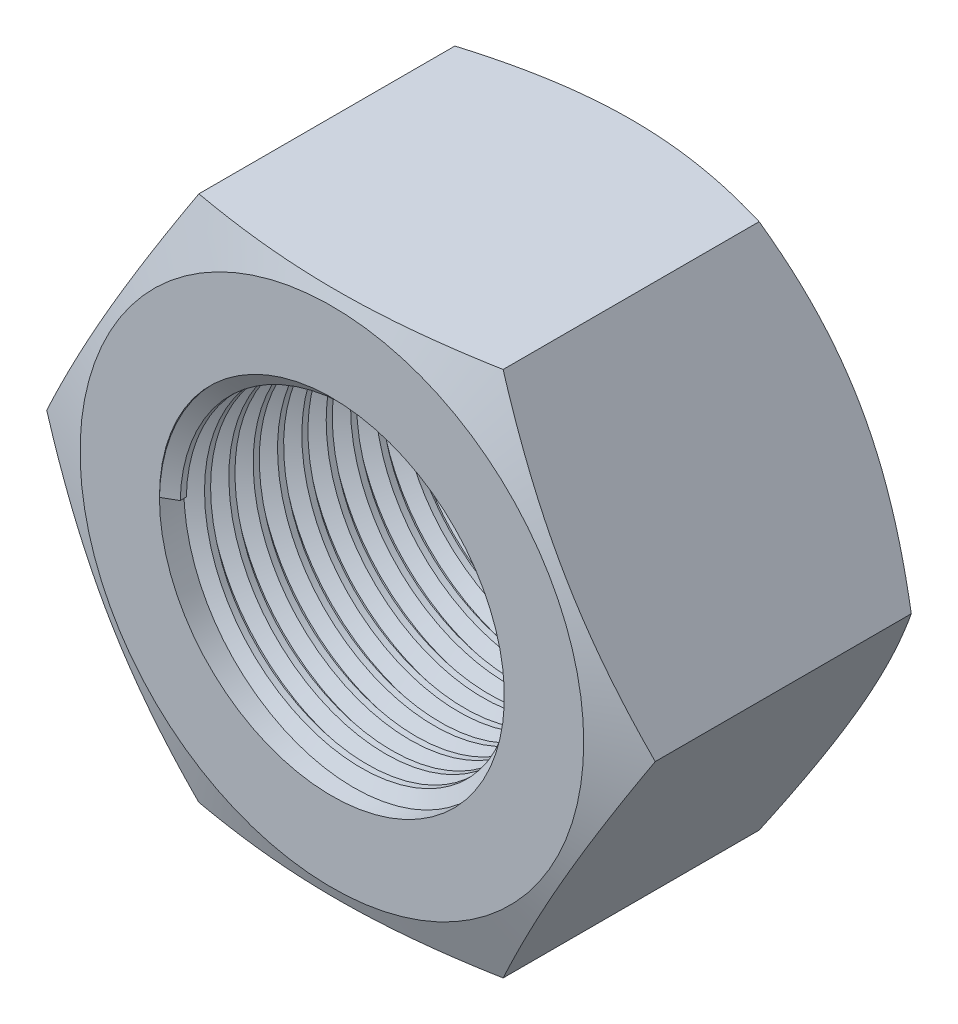
from build123d import *

# Parameters (mm, degrees)
CROQUIS1_R              = 9
SALIENTE_EXTRUIR1_DEPTH = 16
ROSCA1_PITCH            = 1.27
CROQUIS4_R              = 50
CROQUIS4_R_2            = 13.140794451
CORTAR_EXTRUIR1_DEPTH   = 8
CORTAR_EXTRUIR1_DRAFT   = -70
CROQUIS5_R              = 70.447687099
CROQUIS5_R_2            = 13.140794451
CORTAR_EXTRUIR2_DEPTH   = 16
CORTAR_EXTRUIR2_DRAFT   = -59


with BuildPart() as part:
    # Croquis1 → Saliente-Extruir1 (new body)
    with BuildSketch(Plane.XY):
        Polygon((15.877132403, 0), (7.938566201, 13.75), (-7.938566201, 13.75), (-15.877132403, 0), (-7.938566201, -13.75), (7.938566201, -13.75), align=None)
        Circle(CROQUIS1_R, mode=Mode.SUBTRACT)
    extrude(amount=SALIENTE_EXTRUIR1_DEPTH)

    # Rosca1: the profile of Perfil de rosca1 profile screwed along a right-hand helix of 11.811024 turns, 8 arcs to a turn; built about Z, then put on its axis
    rosca1_z = Axis((0, 0, 0), (0, 0, 1))
    rosca1_corners = [(9.0003, 0, -0.000173205), (9.0003, 0, 1.111423202), (8.312592339, 0, 0.714374998), (8.312592339, 0, 0.396874998)]
    with BuildLine(mode=Mode.PRIVATE) as rosca1_profile:
        Line(rosca1_corners[0], rosca1_corners[1])
        Line(rosca1_corners[1], rosca1_corners[2])
        Line(rosca1_corners[2], rosca1_corners[3])
        Line(rosca1_corners[3], rosca1_corners[0])
    rosca1_cap = Face(rosca1_profile.wire())
    rosca1_turn_angles = [0, 22.5, 45, 67.5, 90, 112.5, 135, 157.5, 180, 202.5, 225, 247.5, 270, 292.5, 315, 337.5, 360]
    rosca1_turn_weights = [1, 0.9238795325112867, 1, 0.9238795325112867, 1, 0.9238795325112867, 1, 0.9238795325112867, 1, 0.9238795325112867, 1, 0.9238795325112867, 1, 0.9238795325112867, 1, 0.9238795325112867, 1]
    rosca1_turn_rails = [Edge.make_bspline([Vector(p[0], p[1], 0).rotate(rosca1_z, rosca1_turn_angles[k]) / rosca1_turn_weights[k] + Vector(0, 0, p[2] + ROSCA1_PITCH * rosca1_turn_angles[k] / 360) for k in range(17)], [0, 0, 0, 1, 1, 2, 2, 3, 3, 4, 4, 5, 5, 6, 6, 7, 7, 8, 8, 8], 2, rosca1_turn_weights) for p in rosca1_corners]
    rosca1_turn_sides = [Face.make_surface_from_curves(rosca1_turn_rails[p[0]], rosca1_turn_rails[p[1]]) for p in [(0, 1), (1, 2), (2, 3), (3, 0)]]
    rosca1_last_angles = [3960, 3982.5, 4005, 4027.5, 4050, 4072.5, 4095, 4117.5, 4140, 4162.5, 4185, 4207.5, 4230, 4240.984251969, 4251.968503937]
    rosca1_last_weights = [1, 0.9238795325112867, 1, 0.9238795325112867, 1, 0.9238795325112867, 1, 0.9238795325112867, 1, 0.9238795325112867, 1, 0.9238795325112867, 1, 0.981679591174842, 1]
    rosca1_last_rails = [Edge.make_bspline([Vector(p[0], p[1], 0).rotate(rosca1_z, rosca1_last_angles[k]) / rosca1_last_weights[k] + Vector(0, 0, p[2] + ROSCA1_PITCH * rosca1_last_angles[k] / 360) for k in range(15)], [0, 0, 0, 1, 1, 2, 2, 3, 3, 4, 4, 5, 5, 6, 6, 7, 7, 7], 2, rosca1_last_weights) for p in rosca1_corners]
    rosca1_last_sides = [Face.make_surface_from_curves(rosca1_last_rails[p[0]], rosca1_last_rails[p[1]]) for p in [(0, 1), (1, 2), (2, 3), (3, 0)]]
    rosca1 = Plane(origin=(0, 0, 16), x_dir=(-1, 0, 0), z_dir=(0, 0, -1)) * Solid(Shell([*[p.moved(Location((0, 0, ROSCA1_PITCH * i))) for i in range(11) for p in rosca1_turn_sides], *rosca1_last_sides, rosca1_cap, rosca1_cap.rotate(rosca1_z, 4251.968503937).moved(Location((0, 0, ROSCA1_PITCH * 4251.968503937 / 360)))]))
    add(rosca1)


with BuildPart() as cortar_extruir1_tool:
    # Croquis4 → Cortar-Extruir1 (with draft: the straight prism first)
    with BuildSketch(Plane.XY.offset(16)):
        Circle(CROQUIS4_R)
        Circle(CROQUIS4_R_2, mode=Mode.SUBTRACT)
    extrude(amount=-CORTAR_EXTRUIR1_DEPTH)
    # Cortar-Extruir1: the draft: its side faces are tilted about the plane it starts from
    cortar_extruir1_sides = [cortar_extruir1_tool.faces().sort_by_distance(p)[0] for p in [
        (-50, 0, 12),
        (-13.140794451, 0, 12),
    ]]
    draft(cortar_extruir1_sides, Plane.XY.offset(16), CORTAR_EXTRUIR1_DRAFT)


with BuildPart() as part_1:
    add(part.part)

    # Cortar-Extruir1: cut by cortar_extruir1_tool
    add(cortar_extruir1_tool.part, mode=Mode.SUBTRACT)


with BuildPart() as cortar_extruir2_tool:
    # Croquis5 → Cortar-Extruir2 (with draft: the straight prism first)
    with BuildSketch(Plane(origin=(0, 0, 0), x_dir=(-1, 0, 0), z_dir=(0, 0, -1))):
        Circle(CROQUIS5_R)
        Circle(CROQUIS5_R_2, mode=Mode.SUBTRACT)
    extrude(amount=-CORTAR_EXTRUIR2_DEPTH)
    # Cortar-Extruir2: the draft: its side faces are tilted about the plane it starts from
    cortar_extruir2_sides = [cortar_extruir2_tool.faces().sort_by_distance(p)[0] for p in [
        (70.447687099, 0, 8),
        (13.140794451, 0, 8),
    ]]
    draft(cortar_extruir2_sides, Plane(origin=(0, 0, 0), x_dir=(-1, 0, 0), z_dir=(0, 0, -1)), CORTAR_EXTRUIR2_DRAFT)


with BuildPart() as part_2:
    add(part_1.part)

    # Cortar-Extruir2: cut by cortar_extruir2_tool
    add(cortar_extruir2_tool.part, mode=Mode.SUBTRACT)


solid = part_2.part
